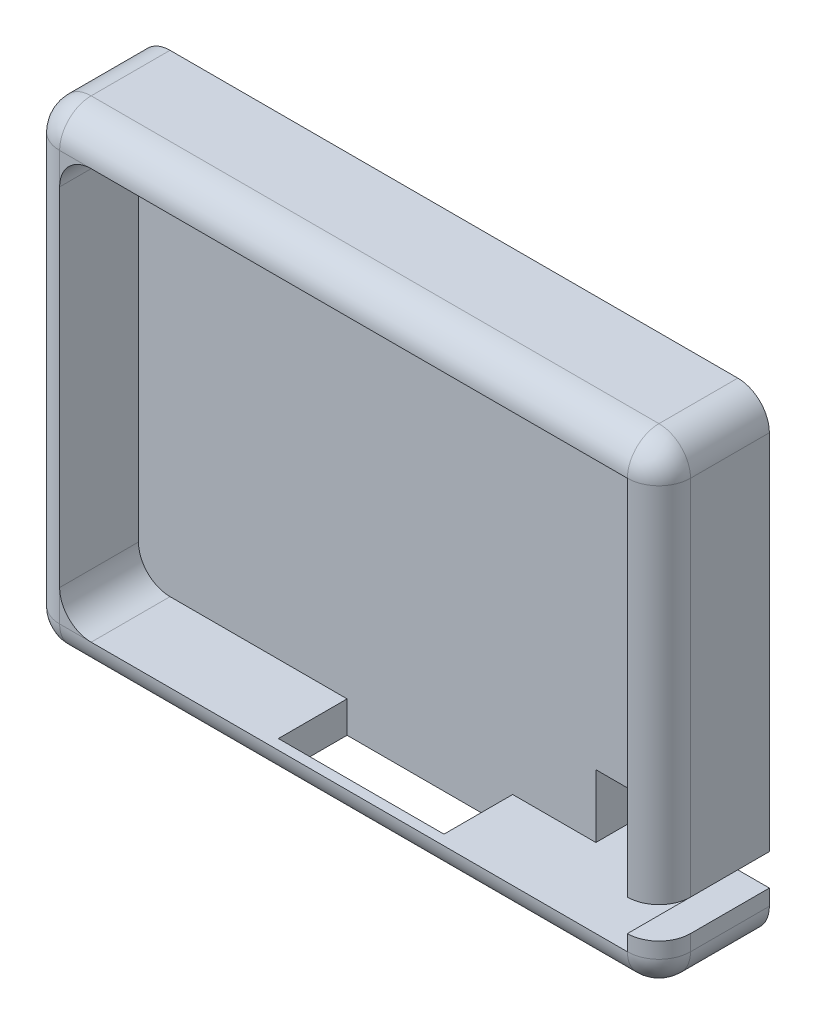
from build123d import *

# Parameters (mm, degrees)
SKETCH1_W           = 40
SKETCH1_H           = 30
BOSS_EXTRUDE1_DEPTH = 7
SKETCH2_W           = 36
SKETCH2_H           = 26
CUT_EXTRUDE1_DEPTH  = 5
FILLET1_R           = 2
FILLET2_R           = 2
SKETCH3_W           = 7
SKETCH3_H           = 4
CUT_EXTRUDE2_DEPTH  = 2
CUT_EXTRUDE3_REACH  = 51.325
SKETCH6_W           = 10.5
SKETCH6_H           = 4.355980474
SKETCH7_W           = 2
SKETCH7_H           = 2
CUT_EXTRUDE4_DEPTH  = 10


with BuildPart() as part:
    # Sketch1 → Boss-Extrude1 (new body)
    with BuildSketch(Plane.XY):
        with Locations((20, 15)):
            Rectangle(SKETCH1_W, SKETCH1_H)
    extrude(amount=BOSS_EXTRUDE1_DEPTH)

    # Sketch2 → Cut-Extrude1 (cut)
    with BuildSketch(Plane.XY.offset(7)):
        with Locations((20, 15)):
            Rectangle(SKETCH2_W, SKETCH2_H)
    extrude(amount=-CUT_EXTRUDE1_DEPTH, mode=Mode.SUBTRACT)

    # Fillet1
    fillet1_edges = [part.edges().sort_by_distance(p)[0] for p in [
        (2, 2, 4.5),
        (2, 28, 4.5),
    ]]
    fillet(fillet1_edges, radius=FILLET1_R)

    # Fillet2
    fillet2_edges = [part.edges().sort_by_distance(p)[0] for p in [
        (40, 15, 7),
        (20, 30, 7),
        (0, 15, 7),
        (20, 0, 7),
        (0, 30, 3.5),
        (40, 30, 3.5),
        (40, 0, 3.5),
        (0, 0, 3.5),
    ]]
    fillet(fillet2_edges, radius=FILLET2_R - 0.0001)  # a hair under: the kernel refuses the full size

    # Sketch3 → Cut-Extrude2 (cut)
    with BuildSketch(Plane.XY.offset(2)):
        with Locations((34.5, 4)):
            Rectangle(SKETCH3_W, SKETCH3_H)
    extrude(amount=-CUT_EXTRUDE2_DEPTH, mode=Mode.SUBTRACT)

    # Cut-Extrude3: up to this face of the body (flat: up to its plane)
    cut_extrude3_end = Plane(part.part.faces().sort_by_distance((20, 0, 2.50005))[0])
    # Sketch6 → Cut-Extrude3 (cut, up to the picked face)
    with BuildSketch(Plane(origin=(0, 2, 0), x_dir=(1, 0, 0), z_dir=(0, 1, 0)), mode=Mode.PRIVATE) as cut_extrude3_sk1:
        with Locations((20.475771031, -4.177990237)):
            Rectangle(SKETCH6_W, SKETCH6_H)
    cut_extrude3_tool1 = split(extrude(cut_extrude3_sk1.sketch, amount=-CUT_EXTRUDE3_REACH, mode=Mode.PRIVATE), bisect_by=cut_extrude3_end, keep=Keep.BOTH, mode=Mode.PRIVATE)
    add(cut_extrude3_tool1.solids().sort_by(Axis((20.475771, 2, 4.17799), (0, -1, 0)))[0], mode=Mode.SUBTRACT)

    # Sketch7 → Cut-Extrude4 (cut)
    with BuildSketch(Plane(origin=(0, 0, 0), x_dir=(-1, 0, 0), z_dir=(0, 0, -1))):
        with Locations((-39, 4)):
            Rectangle(SKETCH7_W, SKETCH7_H)
    extrude(amount=-CUT_EXTRUDE4_DEPTH, mode=Mode.SUBTRACT)


solid = part.part
